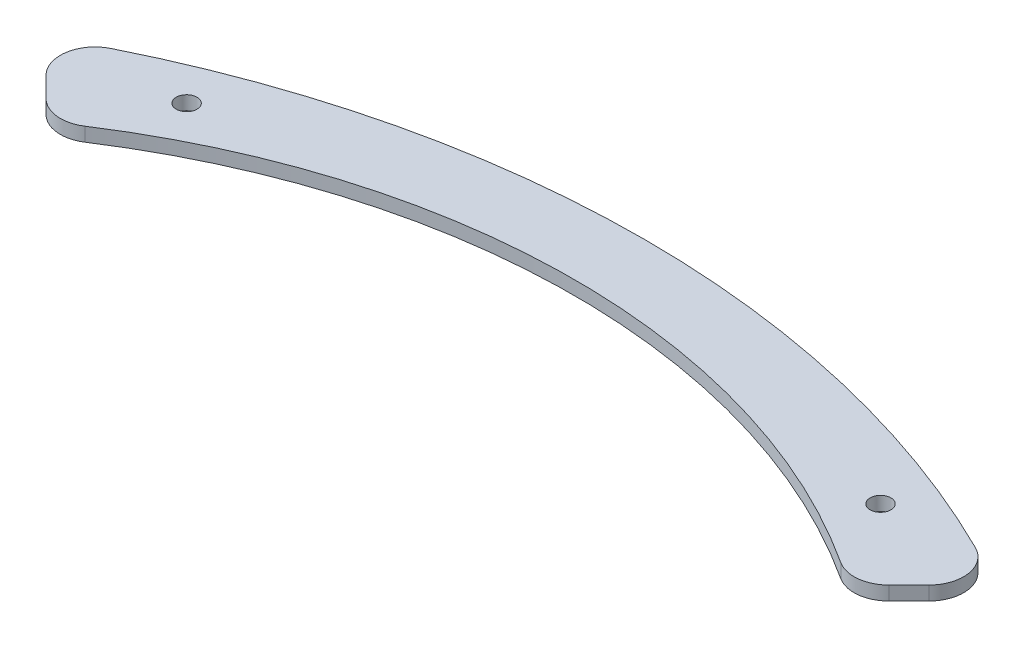
from build123d import *

# Parameters (mm, degrees)
BOSS_EXTRUDE1_DEPTH = 2
FILLET1_R           = 5
CUT_EXTRUDE1_REACH  = 156.401
SKETCH2_R           = 1.5


with BuildPart() as part:
    # Sketch1 → Boss-Extrude1 (new body)
    with BuildSketch(Plane(origin=(0, 0, 0), x_dir=(1, 0, 0), z_dir=(0, 1, 0))):
        with BuildLine():
            Line((-68.408481347, 122.148596717), (-57.801879629, 111.541994999))
            ThreePointArc((-57.801879629, 111.541994999), (0, 129.939649987), (57.801879629, 111.541994999))
            Line((57.801879629, 111.541994999), (68.408481347, 122.148596717))
            ThreePointArc((68.408481347, 122.148596717), (0, 140), (-68.408481347, 122.148596717))
        make_face()
    extrude(amount=BOSS_EXTRUDE1_DEPTH)

    # Fillet1
    fillet1_edges = [part.edges().sort_by_distance(p)[0] for p in [
        (68.408481347, 1, -122.148596717),
        (57.801879629, 1, -111.541994999),
        (-68.408481347, 1, -122.148596717),
        (-57.801879629, 1, -111.541994999),
    ]]
    fillet(fillet1_edges, radius=FILLET1_R)

    # Sketch2 → Cut-Extrude1 (cut, up to next)
    with BuildSketch(Plane(origin=(0, 2, 0), x_dir=(1, 0, 0), z_dir=(0, 1, 0)), mode=Mode.PRIVATE) as cut_extrude1_sk1:
        with Locations((-50, 124)):
            Circle(SKETCH2_R)
    cut_extrude1_tool1 = extrude(cut_extrude1_sk1.sketch, amount=-CUT_EXTRUDE1_REACH, mode=Mode.PRIVATE) & part.part
    # Sketch2 → Cut-Extrude1 (cut, up to next)
    with BuildSketch(Plane(origin=(0, 2, 0), x_dir=(1, 0, 0), z_dir=(0, 1, 0)), mode=Mode.PRIVATE) as cut_extrude1_sk2:
        with Locations((50, 124)):
            Circle(SKETCH2_R)
    cut_extrude1_tool2 = extrude(cut_extrude1_sk2.sketch, amount=-CUT_EXTRUDE1_REACH, mode=Mode.PRIVATE) & part.part
    add(cut_extrude1_tool1.solids().sort_by_distance((-50, 2, -124))[0], mode=Mode.SUBTRACT)
    add(cut_extrude1_tool2.solids().sort_by_distance((50, 2, -124))[0], mode=Mode.SUBTRACT)


solid = part.part
